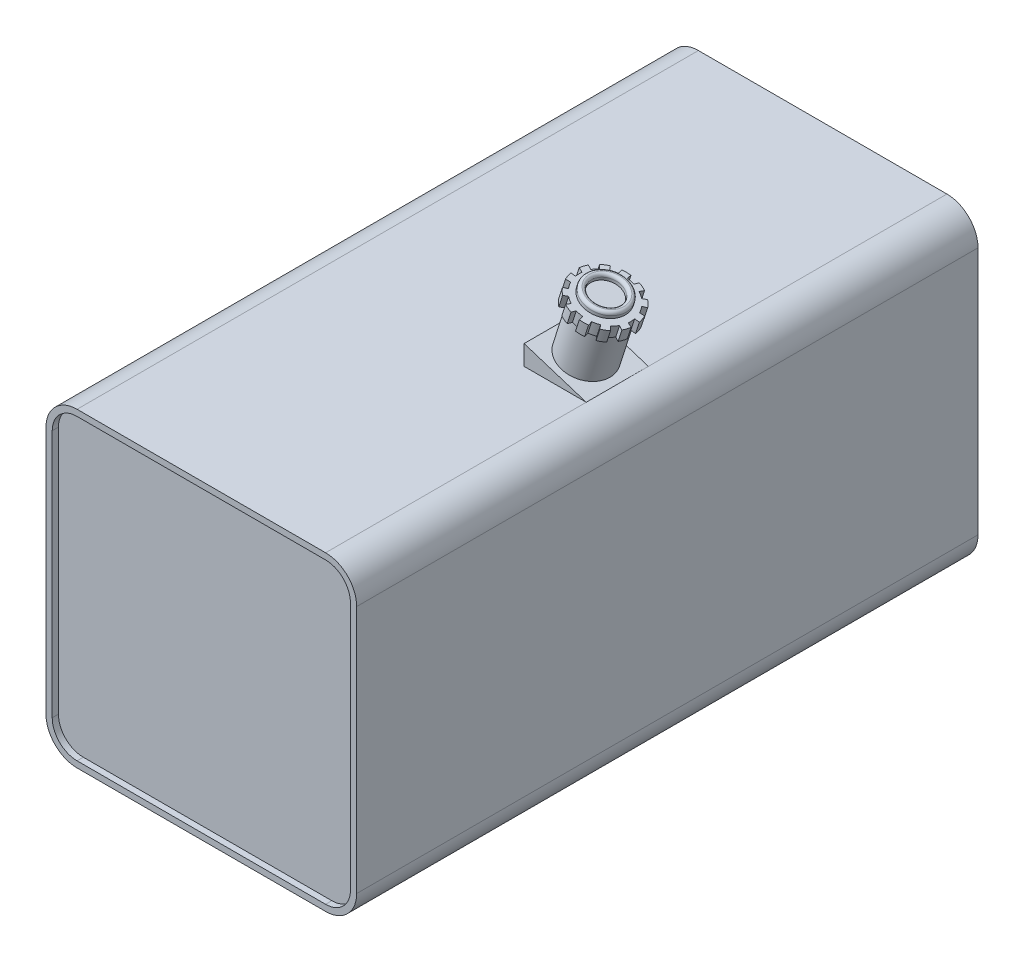
from build123d import *

# Parameters (mm, degrees)
BOSS_EXTRUDE1_DEPTH = 100
SHELL9_T            = -3
CUT_EXTRUDE1_DEPTH  = 1
CUT_EXTRUDE2_START  = -1
CUT_EXTRUDE2_DEPTH  = 1
SKETCH4_W           = 10
SKETCH4_H           = 10
BOSS_EXTRUDE2_DEPTH = 5
CUT_EXTRUDE5_DEPTH  = 10
SKETCH6_W           = 10.495090221
SKETCH6_H           = 10
BOSS_EXTRUDE3_DEPTH = 10
SKETCH7_W           = 10.495090221
SKETCH7_H           = 10
SKETCH7_R           = 4
CUT_EXTRUDE6_DEPTH  = 10
SKETCH8_R           = 5
BOSS_EXTRUDE4_DEPTH = 2
CUT_EXTRUDE7_DEPTH  = 2
CIRPATTERN1_COUNT   = 12
SKETCH10_R          = 3.401579871
SKETCH10_R_2        = 2.401579871
BOSS_EXTRUDE5_DEPTH = 1
FILLET2_R           = 0.5
FILLET3_R           = 0.5
CUT_EXTRUDE8_START  = -3
CUT_EXTRUDE8_DEPTH  = 3


with BuildPart() as part:
    # Sketch1 → Boss-Extrude1 (new body)
    with BuildSketch(Plane.XY):
        with BuildLine():
            Line((-20, 25), (20, 25))
            ThreePointArc((20, 25), (23.535533906, 23.535533906), (25, 20))
            Line((25, 20), (25, -20))
            ThreePointArc((25, -20), (23.535533906, -23.535533906), (20, -25))
            Line((20, -25), (-20, -25))
            ThreePointArc((-20, -25), (-23.535533906, -23.535533906), (-25, -20))
            Line((-25, -20), (-25, 20))
            ThreePointArc((-25, 20), (-23.535533906, 23.535533906), (-20, 25))
        make_face()
    extrude(amount=BOSS_EXTRUDE1_DEPTH)

    # Shell9
    shell9_openings = [part.faces().sort_by_distance(p)[0] for p in [
        (0, 0, 0),
    ]]
    offset(amount=SHELL9_T, openings=shell9_openings, kind=Kind.INTERSECTION)

    # Sketch2 → Cut-Extrude1 (cut)
    with BuildSketch(Plane.XY.offset(100)):
        with BuildLine():
            Line((24, -20), (24, 20))
            ThreePointArc((24, 20), (22.828427125, 22.828427125), (20, 24))
            Line((20, 24), (-20, 24))
            ThreePointArc((-20, 24), (-22.828427125, 22.828427125), (-24, 20))
            Line((-24, 20), (-24, -20))
            ThreePointArc((-24, -20), (-22.828427125, -22.828427125), (-20, -24))
            Line((-20, -24), (20, -24))
            ThreePointArc((20, -24), (22.828427125, -22.828427125), (24, -20))
        make_face()
    extrude(amount=-CUT_EXTRUDE1_DEPTH, mode=Mode.SUBTRACT)

    # Sketch3 → Cut-Extrude2 (cut)
    with BuildSketch(Plane(origin=(0, 0, 0), x_dir=(-1, 0, 0), z_dir=(0, 0, -1)).offset(CUT_EXTRUDE2_START)):
        with BuildLine():
            Line((-20, -24), (20, -24))
            ThreePointArc((20, -24), (22.828427125, -22.828427125), (24, -20))
            Line((24, -20), (24, 20))
            ThreePointArc((24, 20), (22.828427125, 22.828427125), (20, 24))
            Line((20, 24), (-20, 24))
            ThreePointArc((-20, 24), (-22.828427125, 22.828427125), (-24, 20))
            Line((-24, 20), (-24, -20))
            ThreePointArc((-24, -20), (-22.828427125, -22.828427125), (-20, -24))
        make_face()
    extrude(amount=CUT_EXTRUDE2_DEPTH, mode=Mode.SUBTRACT)

    # Sketch4 → Boss-Extrude2 (add)
    with BuildSketch(Plane(origin=(0, 25, 0), x_dir=(1, 0, 0), z_dir=(0, 1, 0))):
        with Locations((15, -53.049640043)):
            Rectangle(SKETCH4_W, SKETCH4_H)
    extrude(amount=BOSS_EXTRUDE2_DEPTH)

    # Sketch5 → Cut-Extrude5 (cut)
    with BuildSketch(Plane.XY.offset(58.049640043)):
        Polygon((10, 28.185422855), (20, 25), (20, 30), (10, 30), align=None)
    extrude(amount=-CUT_EXTRUDE5_DEPTH, mode=Mode.SUBTRACT)

    # Sketch6 → Boss-Extrude3 (add)
    with BuildSketch(Plane(origin=(9.072374427, 28.480910825, 0), x_dir=(0.9528264920711829, -0.3035155284451262, 0), z_dir=(0.3035155284451262, 0.9528264920711829, 0))):
        with Locations((6.22109652, -53.049640043)):
            Rectangle(SKETCH6_W, SKETCH6_H)
    extrude(amount=BOSS_EXTRUDE3_DEPTH)

    # Sketch7 → Cut-Extrude6 (cut)
    with BuildSketch(Plane(origin=(12.107529711, 38.009175746, 0), x_dir=(0.9528264920711829, -0.30351552844512614, 0), z_dir=(0.30351552844512614, 0.952826492071183, 0))):
        with Locations((6.22109652, -53.049640043)):
            Rectangle(SKETCH7_W, SKETCH7_H)
        with Locations(Location((6.221096519, -53.049640043, 0), (0, 0, 180))):
            Circle(SKETCH7_R, mode=Mode.SUBTRACT)
    extrude(amount=-CUT_EXTRUDE6_DEPTH, mode=Mode.SUBTRACT)

    # Sketch8 → Boss-Extrude4 (add)
    with BuildSketch(Plane(origin=(12.107529711, 38.009175746, 0), x_dir=(0.9528264920711829, -0.30351552844512614, 0), z_dir=(0.30351552844512614, 0.952826492071183, 0))):
        with Locations(Location((6.221096519, -53.049640043, 0), (0, 0, 180))):
            Circle(SKETCH8_R)
    extrude(amount=-BOSS_EXTRUDE4_DEPTH)

    # Sketch9 → Cut-Extrude7 (cut)
    with BuildSketch(Plane(origin=(12.107529711, 38.009175746, 0), x_dir=(0.9528264920711829, -0.30351552844512614, 0), z_dir=(0.30351552844512614, 0.952826492071183, 0))):
        with BuildLine():
            ThreePointArc((1.251860541, -52.495840627), (1.222824963, -53.18109898), (1.287841277, -53.863883686))
            Line((1.287841277, -53.863883686), (1.974013697, -53.750629555))
            ThreePointArc((1.974013697, -53.750629555), (1.919851851, -53.218142557), (1.932190971, -52.683050363))
            Line((1.932190971, -52.683050363), (1.251860541, -52.495840627))
        make_face()
    cut_extrude7 = extrude(amount=-CUT_EXTRUDE7_DEPTH, mode=Mode.SUBTRACT)

    # CirPattern1: Cut-Extrude7 ×12 about axis
    cirpattern1_axis = Axis((5.927625573, -1.888199398, 53.049640043), (0.30351552844512614, 0.9528264920711829, 0))
    for i in range(1, CIRPATTERN1_COUNT):
        add(cut_extrude7.rotate(cirpattern1_axis, i * 360 / CIRPATTERN1_COUNT), mode=Mode.SUBTRACT)

    # Sketch10 → Boss-Extrude5 (add)
    with BuildSketch(Plane(origin=(12.107529711, 38.009175746, 0), x_dir=(0.9528264920711829, -0.30351552844512614, 0), z_dir=(0.30351552844512614, 0.952826492071183, 0))):
        with Locations(Location((6.055914609, -52.898554166, 0), (0, 0, 180))):
            Circle(SKETCH10_R)
        with Locations(Location((6.055914609, -52.898554166, 0), (0, 0, 180))):
            Circle(SKETCH10_R_2, mode=Mode.SUBTRACT)
    extrude(amount=BOSS_EXTRUDE5_DEPTH)

    # Fillet2
    fillet2_edges = [part.edges().sort_by_distance(p)[0] for p in [
        (21.422396529, 36.091505803, 52.898554166),
    ]]
    fillet(fillet2_edges, radius=FILLET2_R)

    # Fillet3
    fillet3_edges = [part.edges().sort_by_distance(p)[0] for p in [
        (20.469570037, 36.395021331, 52.898554166),
    ]]
    fillet(fillet3_edges, radius=FILLET3_R - 0.0001)  # a hair under: the kernel refuses the full size

    # Sketch12 → Cut-Extrude8 (cut)
    with BuildSketch(Plane(origin=(0, 0, 1), x_dir=(-1, 0, 0), z_dir=(0, 0, -1)).offset(CUT_EXTRUDE8_START)):
        with BuildLine():
            Line((-20, -24), (20, -24))
            ThreePointArc((20, -24), (22.828427125, -22.828427125), (24, -20))
            Line((24, -20), (24, 20))
            ThreePointArc((24, 20), (22.828427125, 22.828427125), (20, 24))
            Line((20, 24), (-20, 24))
            ThreePointArc((-20, 24), (-22.828427125, 22.828427125), (-24, 20))
            Line((-24, 20), (-24, -20))
            ThreePointArc((-24, -20), (-22.828427125, -22.828427125), (-20, -24))
        make_face()
    extrude(amount=CUT_EXTRUDE8_DEPTH, mode=Mode.SUBTRACT)


solid = part.part
